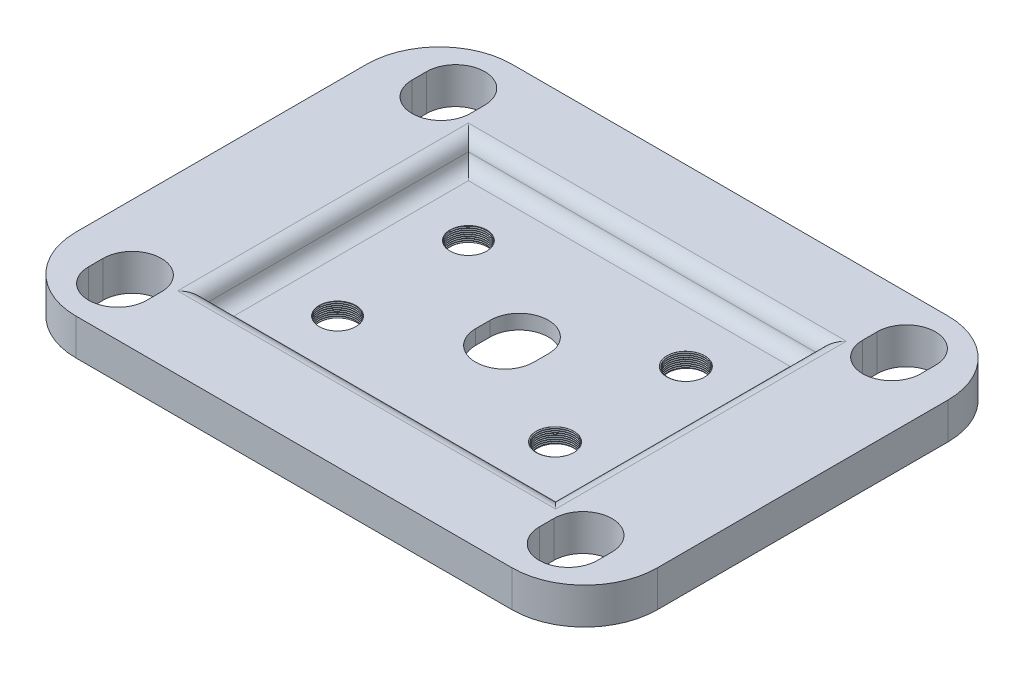
from build123d import *

# Parameters (mm, degrees)
SKETCH1_W                         = 80
SKETCH1_H                         = 60
SKETCH1_W_2                       = 48
SKETCH1_H_2                       = 36
BOSS_EXTRUDE1_DEPTH               = 5
SKETCH1_2_W                       = 48
SKETCH1_2_H                       = 36
BOSS_EXTRUDE2_DEPTH               = 2
CUT_EXTRUDE1_DEPTH                = 51.089919145
F_5_0_5_DIAMETER_HOLE1_AT_2_COUNT = 2
F_5_0_5_DIAMETER_HOLE1_AT_2_PITCH = 18
F_5_0_5_DIAMETER_HOLE1_AT_3_COUNT = 2
F_5_0_5_DIAMETER_HOLE1_AT_3_PITCH = 34.985711369
F_5_0_5_DIAMETER_HOLE1_AT_4_COUNT = 2
F_5_0_5_DIAMETER_HOLE1_AT_4_PITCH = 30
THREAD1_PITCH                     = 0.25
THREAD2_PITCH                     = 0.25
THREAD3_PITCH                     = 0.25
THREAD4_PITCH                     = 0.25
FILLET1_R                         = 10
FILLET2_R                         = 2
FILLET3_R                         = 2
FILLET4_R                         = 2


with BuildPart() as part:
    # Sketch1 → Boss-Extrude1 (new body)
    with BuildSketch(Plane(origin=(0, 0, 0), x_dir=(1, 0, 0), z_dir=(0, 1, 0))):
        Rectangle(SKETCH1_W, SKETCH1_H)
        Rectangle(SKETCH1_W_2, SKETCH1_H_2, mode=Mode.SUBTRACT)
        with BuildLine():
            Line((-27, 23.25), (-27, 21.25))
            ThreePointArc((-27, 21.25), (-31, 17.25), (-35, 21.25))
            Line((-35, 21.25), (-35, 23.25))
            ThreePointArc((-35, 23.25), (-31, 27.25), (-27, 23.25))
        make_face(mode=Mode.SUBTRACT)
        with BuildLine():
            Line((35, 23.25), (35, 21.25))
            ThreePointArc((35, 21.25), (31, 17.25), (27, 21.25))
            Line((27, 21.25), (27, 23.25))
            ThreePointArc((27, 23.25), (31, 27.25), (35, 23.25))
        make_face(mode=Mode.SUBTRACT)
        with BuildLine():
            Line((27, -23.25), (27, -21.25))
            ThreePointArc((27, -21.25), (31, -17.25), (35, -21.25))
            Line((35, -21.25), (35, -23.25))
            ThreePointArc((35, -23.25), (31, -27.25), (27, -23.25))
        make_face(mode=Mode.SUBTRACT)
        with BuildLine():
            Line((-35, -23.25), (-35, -21.25))
            ThreePointArc((-35, -21.25), (-31, -17.25), (-27, -21.25))
            Line((-27, -21.25), (-27, -23.25))
            ThreePointArc((-27, -23.25), (-31, -27.25), (-35, -23.25))
        make_face(mode=Mode.SUBTRACT)
    extrude(amount=BOSS_EXTRUDE1_DEPTH)

    # Sketch1<2> → Boss-Extrude2 (add)
    with BuildSketch(Plane(origin=(0, 0, 0), x_dir=(1, 0, 0), z_dir=(0, 1, 0))):
        Rectangle(SKETCH1_2_W, SKETCH1_2_H)
    extrude(amount=BOSS_EXTRUDE2_DEPTH)

    # Sketch2 → Cut-Extrude1 (cut, through all)
    with BuildSketch(Plane(origin=(0, 2, 0), x_dir=(1, 0, 0), z_dir=(0, 1, 0))):
        with BuildLine():
            Line((4, 1), (4, -1))
            ThreePointArc((4, -1), (0, -5), (-4, -1))
            Line((-4, -1), (-4, 1))
            ThreePointArc((-4, 1), (0, 5), (4, 1))
        make_face()
    extrude(amount=-CUT_EXTRUDE1_DEPTH, mode=Mode.SUBTRACT)

    # Sketch5 → Ø5.0 (5) Diameter Hole1 (revolve, cut)
    with BuildSketch(Plane(origin=(-15, 2, -9), x_dir=(0, 0, 1), z_dir=(1, 0, 0))):
        Polygon((0, 0), (0, 2), (2.5, 2), (2.5, 0.025), (2.525, 0), align=None)
    f_5_0_5_diameter_hole1 = revolve(axis=Axis((-15, 8.35, -9), (0, -1, 0)), mode=Mode.SUBTRACT)

    # Ø5.0 (5) Diameter Hole1 at 2: Ø5.0 (5) Diameter Hole1 ×2
    with Locations(*[(0, 0, i * F_5_0_5_DIAMETER_HOLE1_AT_2_PITCH) for i in range(1, F_5_0_5_DIAMETER_HOLE1_AT_2_COUNT)]):
        add(f_5_0_5_diameter_hole1, mode=Mode.SUBTRACT)

    # Ø5.0 (5) Diameter Hole1 at 3: Ø5.0 (5) Diameter Hole1 ×2
    with Locations(*[Vector(0.8574929257125443, 0, 0.5144957554275262) * (i * F_5_0_5_DIAMETER_HOLE1_AT_3_PITCH) for i in range(1, F_5_0_5_DIAMETER_HOLE1_AT_3_COUNT)]):
        add(f_5_0_5_diameter_hole1, mode=Mode.SUBTRACT)

    # Ø5.0 (5) Diameter Hole1 at 4: Ø5.0 (5) Diameter Hole1 ×2
    with Locations(*[(i * F_5_0_5_DIAMETER_HOLE1_AT_4_PITCH, 0, 0) for i in range(1, F_5_0_5_DIAMETER_HOLE1_AT_4_COUNT)]):
        add(f_5_0_5_diameter_hole1, mode=Mode.SUBTRACT)

    # Thread1: arcs per turn and ends read off the stored shape
    # Thread1: the profile of Thread Profile1 profile screwed along a right-hand helix through 40 turns, 6 arcs to a turn; built about Z, then put on its axis
    thread1_z = Axis((0, 0, 0), (0, 0, 1))
    thread1_corners = [(2.4997, 0, -0.000173205), (2.635316469, 0, 0.078125), (2.635316469, 0, 0.109375), (2.4997, 0, 0.187673204)]
    with BuildLine(mode=Mode.PRIVATE) as thread1_profile:
        Line(thread1_corners[0], thread1_corners[1])
        Line(thread1_corners[1], thread1_corners[2])
        Line(thread1_corners[2], thread1_corners[3])
        Line(thread1_corners[3], thread1_corners[0])
    thread1_cap = Face(thread1_profile.wire())
    thread1_turn_angles = [0, 30, 60, 90, 120, 150, 180, 210, 240, 270, 300, 330, 360]
    thread1_turn_weights = [1, 0.8660254037844387, 1, 0.8660254037844387, 1, 0.8660254037844387, 1, 0.8660254037844387, 1, 0.8660254037844387, 1, 0.8660254037844387, 1]
    thread1_turn_rails = [Edge.make_bspline([Vector(p[0], p[1], 0).rotate(thread1_z, thread1_turn_angles[k]) / thread1_turn_weights[k] + Vector(0, 0, p[2] + THREAD1_PITCH * thread1_turn_angles[k] / 360) for k in range(13)], [0, 0, 0, 1, 1, 2, 2, 3, 3, 4, 4, 5, 5, 6, 6, 6], 2, thread1_turn_weights) for p in thread1_corners]
    thread1_turn_sides = [Face.make_surface_from_curves(thread1_turn_rails[p[0]], thread1_turn_rails[p[1]]) for p in [(0, 1), (1, 2), (2, 3), (3, 0)]]
    thread1 = Plane(origin=(-15, 1.975, 9), x_dir=(-1, 0, 0), z_dir=(0, -1, 0)) * Solid(Shell([*[p.moved(Location((0, 0, THREAD1_PITCH * i))) for i in range(40) for p in thread1_turn_sides], thread1_cap, thread1_cap.rotate(thread1_z, 14400).moved(Location((0, 0, THREAD1_PITCH * 14400 / 360)))]))
    add(thread1, mode=Mode.SUBTRACT)

    # Thread2: arcs per turn and ends read off the stored shape
    # Thread2: the profile of Thread Profile2 profile screwed along a right-hand helix through 40 turns, 6 arcs to a turn; built about Z, then put on its axis
    thread2_z = Axis((0, 0, 0), (0, 0, 1))
    thread2_corners = [(2.4997, 0, -0.000173205), (2.635316469, 0, 0.078125), (2.635316469, 0, 0.109375), (2.4997, 0, 0.187673204)]
    with BuildLine(mode=Mode.PRIVATE) as thread2_profile:
        Line(thread2_corners[0], thread2_corners[1])
        Line(thread2_corners[1], thread2_corners[2])
        Line(thread2_corners[2], thread2_corners[3])
        Line(thread2_corners[3], thread2_corners[0])
    thread2_cap = Face(thread2_profile.wire())
    thread2_turn_angles = [0, 30, 60, 90, 120, 150, 180, 210, 240, 270, 300, 330, 360]
    thread2_turn_weights = [1, 0.8660254037844387, 1, 0.8660254037844387, 1, 0.8660254037844387, 1, 0.8660254037844387, 1, 0.8660254037844387, 1, 0.8660254037844387, 1]
    thread2_turn_rails = [Edge.make_bspline([Vector(p[0], p[1], 0).rotate(thread2_z, thread2_turn_angles[k]) / thread2_turn_weights[k] + Vector(0, 0, p[2] + THREAD2_PITCH * thread2_turn_angles[k] / 360) for k in range(13)], [0, 0, 0, 1, 1, 2, 2, 3, 3, 4, 4, 5, 5, 6, 6, 6], 2, thread2_turn_weights) for p in thread2_corners]
    thread2_turn_sides = [Face.make_surface_from_curves(thread2_turn_rails[p[0]], thread2_turn_rails[p[1]]) for p in [(0, 1), (1, 2), (2, 3), (3, 0)]]
    thread2 = Plane(origin=(-15, 1.975, -9), x_dir=(-1, 0, 0), z_dir=(0, -1, 0)) * Solid(Shell([*[p.moved(Location((0, 0, THREAD2_PITCH * i))) for i in range(40) for p in thread2_turn_sides], thread2_cap, thread2_cap.rotate(thread2_z, 14400).moved(Location((0, 0, THREAD2_PITCH * 14400 / 360)))]))
    add(thread2, mode=Mode.SUBTRACT)

    # Thread3: arcs per turn and ends read off the stored shape
    # Thread3: the profile of Thread Profile3 profile screwed along a right-hand helix through 40 turns, 6 arcs to a turn; built about Z, then put on its axis
    thread3_z = Axis((0, 0, 0), (0, 0, 1))
    thread3_corners = [(2.4997, 0, -0.000173205), (2.635316469, 0, 0.078125), (2.635316469, 0, 0.109375), (2.4997, 0, 0.187673204)]
    with BuildLine(mode=Mode.PRIVATE) as thread3_profile:
        Line(thread3_corners[0], thread3_corners[1])
        Line(thread3_corners[1], thread3_corners[2])
        Line(thread3_corners[2], thread3_corners[3])
        Line(thread3_corners[3], thread3_corners[0])
    thread3_cap = Face(thread3_profile.wire())
    thread3_turn_angles = [0, 30, 60, 90, 120, 150, 180, 210, 240, 270, 300, 330, 360]
    thread3_turn_weights = [1, 0.8660254037844387, 1, 0.8660254037844387, 1, 0.8660254037844387, 1, 0.8660254037844387, 1, 0.8660254037844387, 1, 0.8660254037844387, 1]
    thread3_turn_rails = [Edge.make_bspline([Vector(p[0], p[1], 0).rotate(thread3_z, thread3_turn_angles[k]) / thread3_turn_weights[k] + Vector(0, 0, p[2] + THREAD3_PITCH * thread3_turn_angles[k] / 360) for k in range(13)], [0, 0, 0, 1, 1, 2, 2, 3, 3, 4, 4, 5, 5, 6, 6, 6], 2, thread3_turn_weights) for p in thread3_corners]
    thread3_turn_sides = [Face.make_surface_from_curves(thread3_turn_rails[p[0]], thread3_turn_rails[p[1]]) for p in [(0, 1), (1, 2), (2, 3), (3, 0)]]
    thread3 = Plane(origin=(15, 0, -9), x_dir=(1, 0, 0), z_dir=(0, 1, 0)) * Solid(Shell([*[p.moved(Location((0, 0, THREAD3_PITCH * i))) for i in range(40) for p in thread3_turn_sides], thread3_cap, thread3_cap.rotate(thread3_z, 14400).moved(Location((0, 0, THREAD3_PITCH * 14400 / 360)))]))
    add(thread3, mode=Mode.SUBTRACT)

    # Thread4: arcs per turn and ends read off the stored shape
    # Thread4: the profile of Thread Profile4 profile screwed along a right-hand helix through 40 turns, 6 arcs to a turn; built about Z, then put on its axis
    thread4_z = Axis((0, 0, 0), (0, 0, 1))
    thread4_corners = [(2.4997, 0, -0.000173205), (2.635316469, 0, 0.078125), (2.635316469, 0, 0.109375), (2.4997, 0, 0.187673204)]
    with BuildLine(mode=Mode.PRIVATE) as thread4_profile:
        Line(thread4_corners[0], thread4_corners[1])
        Line(thread4_corners[1], thread4_corners[2])
        Line(thread4_corners[2], thread4_corners[3])
        Line(thread4_corners[3], thread4_corners[0])
    thread4_cap = Face(thread4_profile.wire())
    thread4_turn_angles = [0, 30, 60, 90, 120, 150, 180, 210, 240, 270, 300, 330, 360]
    thread4_turn_weights = [1, 0.8660254037844387, 1, 0.8660254037844387, 1, 0.8660254037844387, 1, 0.8660254037844387, 1, 0.8660254037844387, 1, 0.8660254037844387, 1]
    thread4_turn_rails = [Edge.make_bspline([Vector(p[0], p[1], 0).rotate(thread4_z, thread4_turn_angles[k]) / thread4_turn_weights[k] + Vector(0, 0, p[2] + THREAD4_PITCH * thread4_turn_angles[k] / 360) for k in range(13)], [0, 0, 0, 1, 1, 2, 2, 3, 3, 4, 4, 5, 5, 6, 6, 6], 2, thread4_turn_weights) for p in thread4_corners]
    thread4_turn_sides = [Face.make_surface_from_curves(thread4_turn_rails[p[0]], thread4_turn_rails[p[1]]) for p in [(0, 1), (1, 2), (2, 3), (3, 0)]]
    thread4 = Plane(origin=(15, 0, 9), x_dir=(1, 0, 0), z_dir=(0, 1, 0)) * Solid(Shell([*[p.moved(Location((0, 0, THREAD4_PITCH * i))) for i in range(40) for p in thread4_turn_sides], thread4_cap, thread4_cap.rotate(thread4_z, 14400).moved(Location((0, 0, THREAD4_PITCH * 14400 / 360)))]))
    add(thread4, mode=Mode.SUBTRACT)

    # Fillet1
    fillet1_edges = [part.edges().sort_by_distance(p)[0] for p in [
        (40, 2.5, 30),
        (-40, 2.5, 30),
        (-40, 2.5, -30),
        (40, 2.5, -30),
    ]]
    fillet(fillet1_edges, radius=FILLET1_R)

    # Fillet2
    fillet2_edges = [part.edges().sort_by_distance(p)[0] for p in [
        (24, 5, 0),
        (0, 5, -18),
    ]]
    fillet(fillet2_edges, radius=FILLET2_R)

    # Fillet3
    fillet3_edges = [part.edges().sort_by_distance(p)[0] for p in [
        (1, 5, 18),
        (-24, 5, -1),
    ]]
    fillet(fillet3_edges, radius=FILLET3_R)

    # Fillet4
    fillet4_edges = [part.edges().sort_by_distance(p)[0] for p in [
        (-24, 2, 0),
        (0, 2, 18),
        (24, 2, 0),
        (0, 2, -18),
    ]]
    fillet(fillet4_edges, radius=FILLET4_R)


solid = part.part
